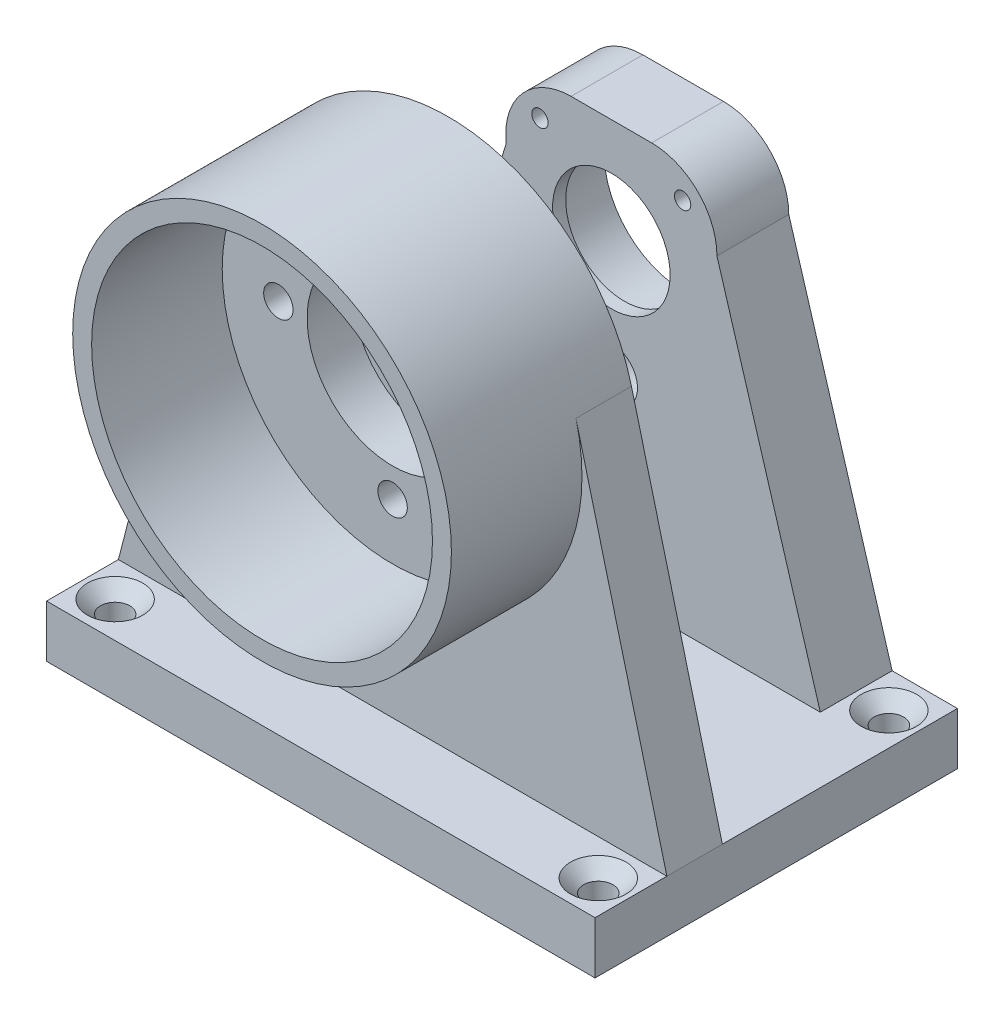
from build123d import *

# Parameters (mm, degrees)
SCHIZZO1_R                   = 12.1
ESTRUSIONE_ESTRUSIONE1_DEPTH = 11
ESTRUSIONE_ESTRUSIONE2_START = -2
SCHIZZO2_R                   = 12.1
SCHIZZO2_R_2                 = 9
ESTRUSIONE_ESTRUSIONE2_DEPTH = 2
SCHIZZO3_R                   = 2.25
TAGLIO_ESTRUSIONE1_DEPTH     = 77.182412669
SMUSSO1_SIZE                 = 2
SCHIZZO4_R                   = 1.25
TAGLIO_ESTRUSIONE2_DEPTH     = 70.679623994
SCHIZZO5_W                   = 84
SCHIZZO5_H                   = 8
ESTRUSIONE_ESTRUSIONE3_DEPTH = 25
SCHIZZO6_R                   = 2.25
SCHIZZO6_R_2                 = 6
ESTRUSIONE_ESTRUSIONE4_DEPTH = 1.5
SCHIZZO7_R                   = 2.25
SCHIZZO7_R_2                 = 13.1
ESTRUSIONE_ESTRUSIONE5_DEPTH = 7
SCHIZZO8_R                   = 29
SCHIZZO8_R_2                 = 26.1
ESTRUSIONE_ESTRUSIONE6_DEPTH = 20
TAGLIO_ESTRUSIONE4_REACH     = 96.311
SCHIZZO9_R                   = 4
ESTRUSIONE_ESTRUSIONE7_DEPTH = 11
SCHIZZO11_R                  = 2.25
TAGLIO_ESTRUSIONE5_DEPTH     = 108.816974545
SMUSSO2_SIZE                 = 2


with BuildPart() as part:
    # Schizzo1 → Estrusione-Estrusione1 (new body)
    with BuildSketch(Plane.XY):
        with BuildLine():
            Line((-6.171311325, 16.1), (6.171311325, 16.1))
            ThreePointArc((6.171311325, 16.1), (13.242379137, 13.171067812), (16.171311325, 6.1))
            Line((16.171311325, 6.1), (32, -46.5))
            Line((32, -46.5), (42, -46.5))
            Line((42, -46.5), (42, -54.5))
            Line((42, -54.5), (17, -54.5))
            Line((17, -54.5), (-17, -54.5))
            Line((-17, -54.5), (-42, -54.5))
            Line((-42, -54.5), (-42, -46.5))
            Line((-42, -46.5), (-32, -46.5))
            Line((-32, -46.5), (-16.1, 4.907883736))
            ThreePointArc((-16.1, 4.907883736), (-13.651991863, 12.73622021), (-6.171311325, 16.1))
        make_face()
        Circle(SCHIZZO1_R, mode=Mode.SUBTRACT)
    extrude(amount=ESTRUSIONE_ESTRUSIONE1_DEPTH)

    # Schizzo2 → Estrusione-Estrusione2 (add)
    with BuildSketch(Plane.XY.offset(11).offset(ESTRUSIONE_ESTRUSIONE2_START)):
        Circle(SCHIZZO2_R)
        Circle(SCHIZZO2_R_2, mode=Mode.SUBTRACT)
    extrude(amount=ESTRUSIONE_ESTRUSIONE2_DEPTH)

    # Schizzo3 → Taglio-Estrusione1 (cut, through all)
    with BuildSketch(Plane(origin=(0, -46.5, 0), x_dir=(1, 0, 0), z_dir=(0, 1, 0))):
        with Locations((37, -5.5)):
            Circle(SCHIZZO3_R)
        with Locations((-37, -5.5)):
            Circle(SCHIZZO3_R)
    extrude(amount=-TAGLIO_ESTRUSIONE1_DEPTH, mode=Mode.SUBTRACT)

    # Smusso1
    smusso1_edges = [part.edges().sort_by_distance(p)[0] for p in [
        (-39.25, -46.5, 5.5),
        (34.75, -46.5, 5.5),
    ]]
    chamfer(smusso1_edges, length=SMUSSO1_SIZE)

    # Schizzo4 → Taglio-Estrusione2 (cut, through all)
    with BuildSketch(Plane(origin=(0, 0, 0), x_dir=(-1, 0, 0), z_dir=(0, 0, -1))):
        with Locations((-10.910719744, 10.851964601)):
            Circle(SCHIZZO4_R)
        with Locations((10.944459062, 10.817992606)):
            Circle(SCHIZZO4_R)
        with Locations((0, -15.38859776)):
            Circle(SCHIZZO4_R)
    extrude(amount=-TAGLIO_ESTRUSIONE2_DEPTH, mode=Mode.SUBTRACT)

    # Schizzo5 → Estrusione-Estrusione3 (add)
    with BuildSketch(Plane.XY.offset(11)):
        with Locations((0, -50.5)):
            Rectangle(SCHIZZO5_W, SCHIZZO5_H)
    extrude(amount=ESTRUSIONE_ESTRUSIONE3_DEPTH)

    # Schizzo6 → Estrusione-Estrusione4 (add)
    with BuildSketch(Plane.XY.offset(36)):
        with BuildLine():
            Line((-28.073726485, 7.270892739), (-42, -46.5))
            Line((-42, -46.5), (-42, -54.5))
            Line((-42, -54.5), (42, -54.5))
            Line((42, -54.5), (42, -46.5))
            Line((42, -46.5), (28.073726485, 7.270892739))
            ThreePointArc((28.073726485, 7.270892739), (0, 29), (-28.073726485, 7.270892739))
        make_face()
        with Locations((17.5, 0)):
            Circle(SCHIZZO6_R, mode=Mode.SUBTRACT)
        with Locations((0, 17.5)):
            Circle(SCHIZZO6_R, mode=Mode.SUBTRACT)
        with Locations((-17.5, 0)):
            Circle(SCHIZZO6_R, mode=Mode.SUBTRACT)
        with Locations((0, -17.5)):
            Circle(SCHIZZO6_R, mode=Mode.SUBTRACT)
        Circle(SCHIZZO6_R_2, mode=Mode.SUBTRACT)
    extrude(amount=ESTRUSIONE_ESTRUSIONE4_DEPTH)

    # Schizzo7 → Estrusione-Estrusione5 (add)
    with BuildSketch(Plane.XY.offset(37.5)):
        with BuildLine():
            Line((42, -46.5), (28.073726485, 7.270892739))
            ThreePointArc((28.073726485, 7.270892739), (0, 29), (-28.073726485, 7.270892739))
            Line((-28.073726485, 7.270892739), (-42, -46.5))
            Line((-42, -46.5), (-42, -54.5))
            Line((-42, -54.5), (42, -54.5))
            Line((42, -54.5), (42, -46.5))
        make_face()
        with Locations((0, -17.5)):
            Circle(SCHIZZO7_R, mode=Mode.SUBTRACT)
        with Locations((17.5, 0)):
            Circle(SCHIZZO7_R, mode=Mode.SUBTRACT)
        with Locations((0, 17.5)):
            Circle(SCHIZZO7_R, mode=Mode.SUBTRACT)
        with Locations((-17.5, 0)):
            Circle(SCHIZZO7_R, mode=Mode.SUBTRACT)
        Circle(SCHIZZO7_R_2, mode=Mode.SUBTRACT)
    extrude(amount=ESTRUSIONE_ESTRUSIONE5_DEPTH)

    # Schizzo8 → Estrusione-Estrusione6 (add)
    with BuildSketch(Plane.XY.offset(44.5)):
        Circle(SCHIZZO8_R)
        Circle(SCHIZZO8_R_2, mode=Mode.SUBTRACT)
    extrude(amount=ESTRUSIONE_ESTRUSIONE6_DEPTH)

    # Schizzo9 → Taglio-Estrusione4 (cut, up to next)
    with BuildSketch(Plane(origin=(0, 0, 0), x_dir=(-1, 0, 0), z_dir=(0, 0, -1)), mode=Mode.PRIVATE) as taglio_estrusione4_sk1:
        with Locations((0, -17.5)):
            Circle(SCHIZZO9_R)
    taglio_estrusione4_tool1 = extrude(taglio_estrusione4_sk1.sketch, amount=-TAGLIO_ESTRUSIONE4_REACH, mode=Mode.PRIVATE) & part.part
    add(taglio_estrusione4_tool1.solids().sort_by_distance((0, -17.5, 0))[0], mode=Mode.SUBTRACT)

    # Schizzo10 → Estrusione-Estrusione7 (add)
    with BuildSketch(Plane.XY.offset(44.5)):
        Polygon((-32, -46.5), (-42, -46.5), (-42, -54.5), (42, -54.5), (42, -46.5), (32, -46.5), align=None)
    extrude(amount=ESTRUSIONE_ESTRUSIONE7_DEPTH)

    # Schizzo11 → Taglio-Estrusione5 (cut, through all)
    with BuildSketch(Plane(origin=(0, -46.5, 0), x_dir=(1, 0, 0), z_dir=(0, 1, 0))):
        with Locations((-37, -50)):
            Circle(SCHIZZO11_R)
        with Locations((37, -50)):
            Circle(SCHIZZO11_R)
    extrude(amount=-TAGLIO_ESTRUSIONE5_DEPTH, mode=Mode.SUBTRACT)

    # Smusso2
    smusso2_edges = [part.edges().sort_by_distance(p)[0] for p in [
        (-39.25, -46.5, 50),
        (34.75, -46.5, 50),
    ]]
    chamfer(smusso2_edges, length=SMUSSO2_SIZE)


solid = part.part
